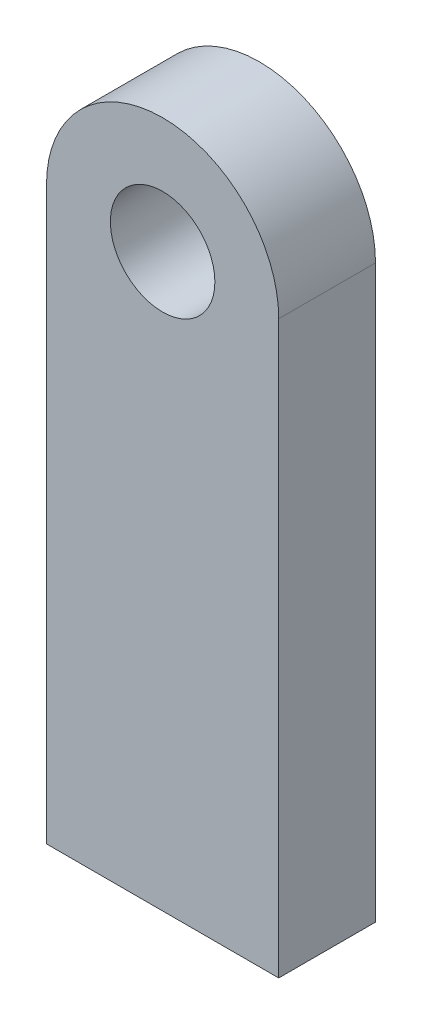
from build123d import *

# Parameters (mm, degrees)
SKETCH1_R           = 3.429
BOSS_EXTRUDE1_DEPTH = 6.35


with BuildPart() as part:
    # Sketch1 → Boss-Extrude1 (new body)
    with BuildSketch(Plane.XY):
        with BuildLine():
            Line((0, 37.465), (0, 0))
            Line((0, 0), (15.24, 0))
            Line((15.24, 0), (15.24, 37.465))
            ThreePointArc((15.24, 37.465), (7.62, 45.085), (0, 37.465))
        make_face()
        with Locations((7.62, 37.465)):
            Circle(SKETCH1_R, mode=Mode.SUBTRACT)
    extrude(amount=BOSS_EXTRUDE1_DEPTH)


solid = part.part
